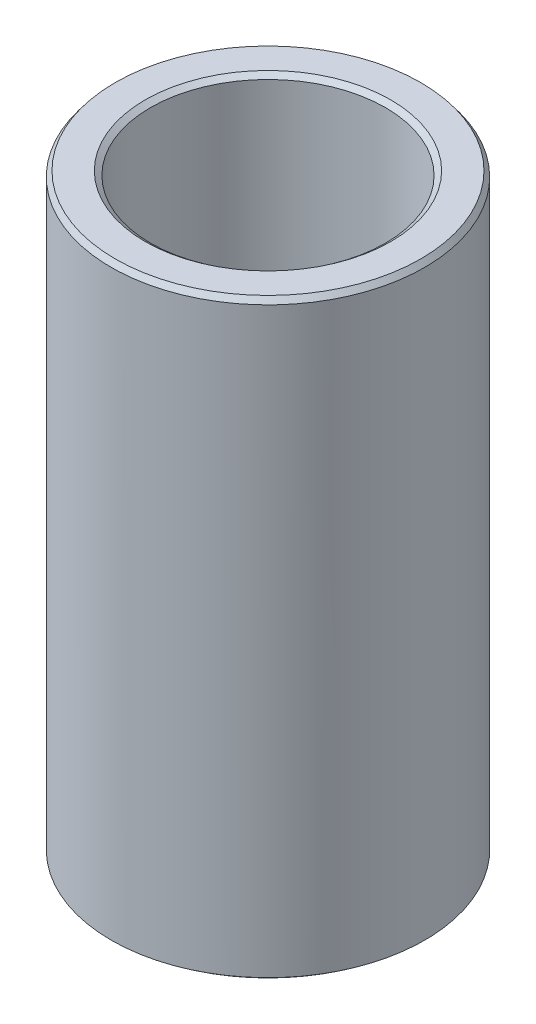
from build123d import *
from OCP.BRepFilletAPI import BRepFilletAPI_MakeChamfer

# Parameters (mm, degrees)
SKETCH1_R           = 55
BOSS_EXTRUDE1_DEPTH = 207.695562974
SKETCH2_R           = 41.208133925
CUT_EXTRUDE1_DEPTH  = 222.782431404
CHAMFER1_SIZE       = 1.872587289
CHAMFER1_SIZE2      = 1.410543141


with BuildPart() as part:
    # Sketch1 → Boss-Extrude1 (new body)
    with BuildSketch(Plane(origin=(0, 0, 0), x_dir=(1, 0, 0), z_dir=(0, 1, 0))):
        Circle(SKETCH1_R)
    extrude(amount=BOSS_EXTRUDE1_DEPTH)

    # Sketch2 → Cut-Extrude1 (cut, through all)
    with BuildSketch(Plane(origin=(0, 0, 0), x_dir=(1, 0, 0), z_dir=(0, 1, 0))):
        Circle(SKETCH2_R)
    extrude(amount=CUT_EXTRUDE1_DEPTH, mode=Mode.SUBTRACT)

    # Chamfer1: one chamfer whose edges measure the first distance from different faces: ONE call of the kernel's chamfer builder (chamfer() names one face for all edges)
    chamfer1_edges_1 = [part.edges().sort_by_distance(p)[0] for p in [
        (-41.208133925, 207.695562974, 0),
    ]]
    chamfer1_side_1 = [part.faces().sort_by_distance(p)[0] for p in [
        (-53.444365081, 207.695562974, 0),
    ]]
    chamfer1_edges_2 = [part.edges().sort_by_distance(p)[0] for p in [
        (-41.208133925, 0, 0),
    ]]
    chamfer1_side_2 = [part.faces().sort_by_distance(p)[0] for p in [
        (-41.208133925, 103.847781487, 0),
    ]]
    chamfer1_edges_3 = [part.edges().sort_by_distance(p)[0] for p in [
        (-55, 0, 0),
    ]]
    chamfer1_side_3 = [part.faces().sort_by_distance(p)[0] for p in [
        (-53.444365081, 0, 0),
    ]]
    chamfer1_edges_4 = [part.edges().sort_by_distance(p)[0] for p in [
        (-55, 207.695562974, 0),
    ]]
    chamfer1_side_4 = [part.faces().sort_by_distance(p)[0] for p in [
        (-55, 103.847781487, 0),
    ]]
    chamfer1 = BRepFilletAPI_MakeChamfer(part.part.solid().wrapped)
    for e in chamfer1_edges_1:
        chamfer1.Add(CHAMFER1_SIZE, CHAMFER1_SIZE2, e.wrapped, chamfer1_side_1[0].wrapped)  # the first distance lies on this face
    for e in chamfer1_edges_2:
        chamfer1.Add(CHAMFER1_SIZE, CHAMFER1_SIZE2, e.wrapped, chamfer1_side_2[0].wrapped)  # the first distance lies on this face
    for e in chamfer1_edges_3:
        chamfer1.Add(CHAMFER1_SIZE, CHAMFER1_SIZE2, e.wrapped, chamfer1_side_3[0].wrapped)  # the first distance lies on this face
    for e in chamfer1_edges_4:
        chamfer1.Add(CHAMFER1_SIZE, CHAMFER1_SIZE2, e.wrapped, chamfer1_side_4[0].wrapped)  # the first distance lies on this face
    add(Compound.cast(chamfer1.Shape()), mode=Mode.REPLACE)


solid = part.part
